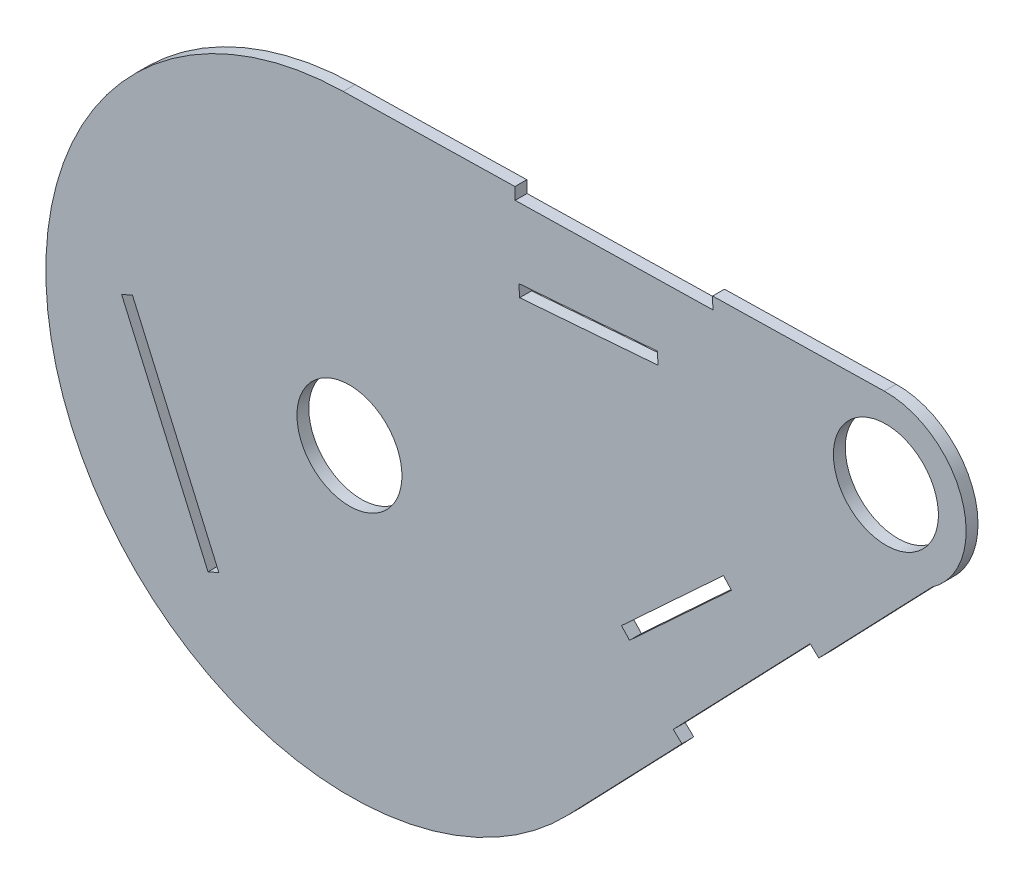
from build123d import *

# Parameters (mm, degrees)
SKETCH1_R           = 6.7437
BOSS_EXTRUDE1_DEPTH = 1.524
CUT_EXTRUDE1_DEPTH  = 1.524


with BuildPart() as part:
    # Sketch1 → Boss-Extrude1 (new body)
    with BuildSketch(Plane.XY):
        with BuildLine():
            Line((15.402470883, -13.334910067), (-31.30492796, -62.017657837))
            ThreePointArc((-31.30492796, -62.017657837), (-95.178118783, -50.675716026), (-60.246096771, 3.988513485))
            Line((-60.246096771, 3.988513485), (9.258899336, 5.401825794))
            ThreePointArc((9.258899336, 5.401825794), (19.264321769, -1.69307822), (15.402470883, -13.334910067))
        make_face()
        with Locations((9.468478572, -4.905028475)):
            Circle(SKETCH1_R, mode=Mode.SUBTRACT)
        with Locations((-59.45306863, -35.011654825)):
            Circle(SKETCH1_R, mode=Mode.SUBTRACT)
        Polygon((-37.582550188, -7.629934287), (-37.700076207, -6.11047266), (-19.907659943, -4.734280059), (-19.790133924, -6.253741686), align=None, mode=Mode.SUBTRACT)
        Polygon((-11.402854487, -25.454307998), (-24.502826911, -37.572670307), (-23.467926073, -38.691400058), (-10.367953649, -26.573037748), align=None, mode=Mode.SUBTRACT)
        Polygon((-88.723379974, -32.829726077), (-77.622261772, -58.148064626), (-76.226531276, -57.536090457), (-87.327649479, -32.217751908), align=None, mode=Mode.SUBTRACT)
    extrude(amount=BOSS_EXTRUDE1_DEPTH)

    # Sketch3 → Cut-Extrude1 (cut)
    with BuildSketch(Plane.XY.offset(1.524)):
        Polygon((0.841178516, -28.51202849), (-0.258532139, -27.456939643), (-17.84334625, -45.785450567), (-16.743635594, -46.840539414), align=None)
        Polygon((-38.190973996, 4.436981628), (-38.159991434, 2.913296594), (-12.765240878, 3.429672618), (-12.79622344, 4.953357652), align=None)
    extrude(amount=-CUT_EXTRUDE1_DEPTH, mode=Mode.SUBTRACT)


solid = part.part
